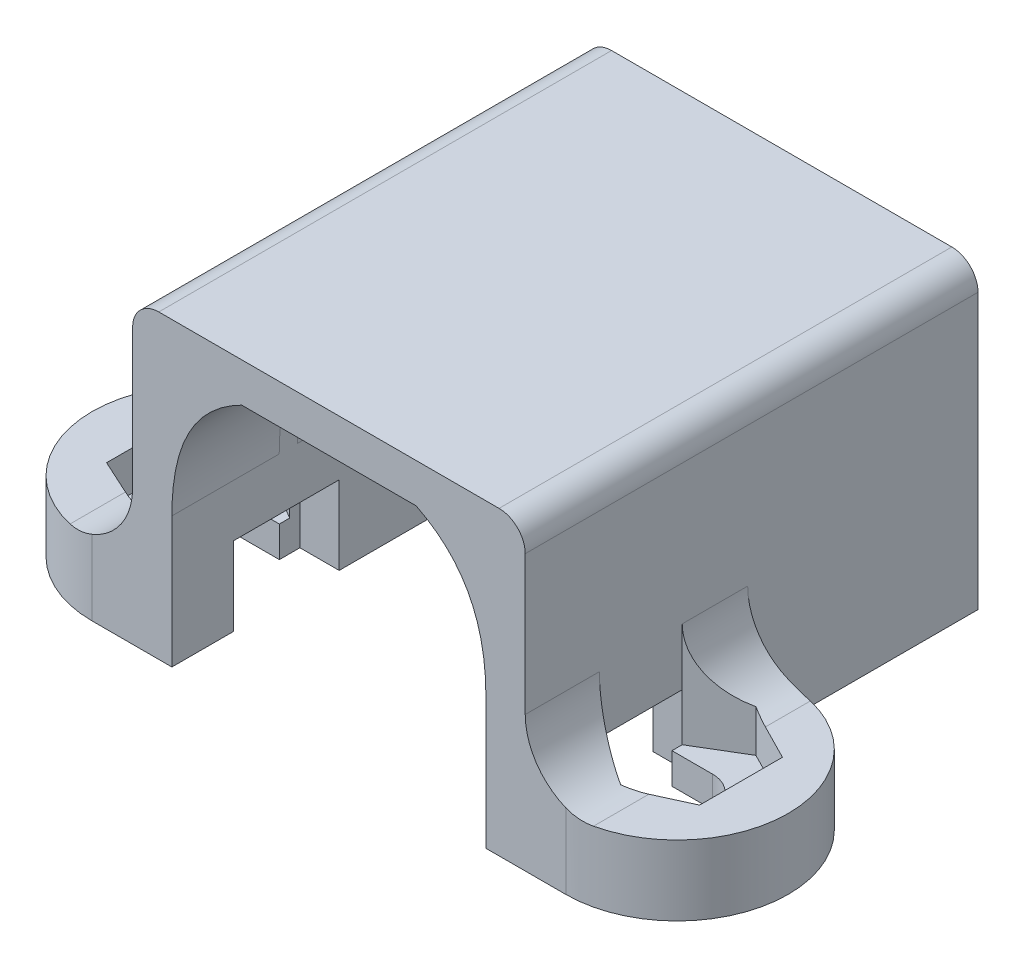
from build123d import *

# Parameters (mm, degrees)
BOSS_EXTRUDE1_DEPTH      = 8.65
BOSS_EXTRUDE1_DEPTH_BACK = 8.65
SKETCH2_W                = 26.6
SKETCH2_H                = 11.5
CUT_EXTRUDE1_DEPTH       = 23.566402017
SKETCH4_W                = 5.8
SKETCH4_H                = 8.8
CUT_EXTRUDE2_DEPTH       = 20.594961087
SKETCH5_W                = 1.5
SKETCH5_H                = 4.03
CUT_EXTRUDE3_DEPTH       = 3
CUT_EXTRUDE4_DEPTH       = 1.4
CUT_EXTRUDE5_START       = -5.1792
CUT_EXTRUDE5_DEPTH       = 4
FILLET3_START            = -7
FILLET3_DEPTH            = 6.429203884
FILLET4_START            = -7
FILLET4_DEPTH            = 6.429203884
CUT_EXTRUDE6_DEPTH       = 23.566402102
FILLET5_R                = 1
SKETCH12_W               = 12
SKETCH12_H               = 1.4
SKETCH12_H_2             = 0.7
CUT_EXTRUDE7_DEPTH       = 10


with BuildPart() as part:
    # Sketch2 → Boss-Extrude1 (new, two sides: drawn at the far end of the back side and taken through both)
    with BuildSketch(Plane.XY.offset(-BOSS_EXTRUDE1_DEPTH_BACK)):
        Rectangle(SKETCH2_W, SKETCH2_H)
    extrude(amount=BOSS_EXTRUDE1_DEPTH + BOSS_EXTRUDE1_DEPTH_BACK)

    # Sketch3 → Cut-Extrude1 (cut, through all)
    with BuildSketch(Plane.XY.offset(8.65)):
        with BuildLine():
            Line((-7.5, 5.75), (-7.5, -0.570796116))
            ThreePointArc((-7.5, -0.570796116), (-8.232233047, -2.338563069), (-10, -3.070796116))
            Line((-10, -3.070796116), (-13.3, -3.070796116))
            Line((-13.3, -3.070796116), (-13.3, 5.75))
            Line((-13.3, 5.75), (-7.5, 5.75))
        make_face()
        with BuildLine():
            Line((7.5, 5.75), (7.5, -0.570796116))
            ThreePointArc((7.5, -0.570796116), (8.232233047, -2.338563069), (10, -3.070796116))
            Line((10, -3.070796116), (13.3, -3.070796116))
            Line((13.3, -3.070796116), (13.3, 5.75))
            Line((13.3, 5.75), (7.5, 5.75))
        make_face()
    extrude(amount=-CUT_EXTRUDE1_DEPTH, mode=Mode.SUBTRACT)

    # Sketch4 → Cut-Extrude2 (cut, through all)
    with BuildSketch(Plane.XZ.offset(5.75)):
        with Locations((-10.4, -4.25)):
            Rectangle(SKETCH4_W, SKETCH4_H)
        with Locations((10.4, -4.25)):
            Rectangle(SKETCH4_W, SKETCH4_H)
    extrude(amount=-CUT_EXTRUDE2_DEPTH, mode=Mode.SUBTRACT)

    # Sketch5 → Cut-Extrude3 (cut)
    with BuildSketch(Plane.XZ.offset(5.75)):
        with Locations((-6.75, 4.27363419)):
            Rectangle(SKETCH5_W, SKETCH5_H)
    cut_extrude3 = extrude(amount=-CUT_EXTRUDE3_DEPTH, mode=Mode.SUBTRACT)

    # Sketch5<3> → Cut-Extrude4 (cut)
    with BuildSketch(Plane.XZ.offset(5.75)):
        with BuildLine():
            ThreePointArc((-9.05, 3.04359822), (-10.2, 4.19359822), (-9.05, 5.34359822))
            Line((-9.05, 5.34359822), (-7.5, 5.34359822))
            Line((-7.5, 5.34359822), (-7.5, 3.04359822))
            Line((-7.5, 3.04359822), (-9.05, 3.04359822))
        make_face()
    cut_extrude4 = extrude(amount=-CUT_EXTRUDE4_DEPTH, mode=Mode.SUBTRACT)

    # Sketch8 → Cut-Extrude5 (cut)
    with BuildSketch(Plane.XZ.offset(5.75).offset(CUT_EXTRUDE5_START)):
        Polygon((-11.329479063, 5.816116205), (-11.329479063, 2.651116205), (-9.259735425, 1.596272871), (-7.5, 2.651116205), (-7.5, 5.816116205), (-9.259735425, 6.763868097), align=None)
    cut_extrude5 = extrude(amount=CUT_EXTRUDE5_DEPTH, mode=Mode.SUBTRACT)

    # Fillet3: read off the stored shape, not the designer's step
    # Fillet3 outline → Fillet3 (cut)
    with BuildSketch(Plane(origin=(0, 0, 0), x_dir=(1, 0, 0), z_dir=(0, 1, 0)).offset(FILLET3_START)):
        with BuildLine():
            Line((-13.3, -8.65), (-9.05, -8.65))
            ThreePointArc((-9.05, -8.65), (-12.05520382, -7.40520382), (-13.3, -4.4))
            Line((-13.3, -4.4), (-13.3, -8.65))
        make_face()
        with BuildLine():
            Line((-13.3, -0.15), (-13.3, -4.4))
            ThreePointArc((-13.3, -4.4), (-12.05520382, -1.39479618), (-9.05, -0.15))
            Line((-9.05, -0.15), (-13.3, -0.15))
        make_face()
    extrude(amount=FILLET3_DEPTH, mode=Mode.SUBTRACT)

    # Mirror4: Cut-Extrude3, Cut-Extrude4, Cut-Extrude5 across plane
    add(cut_extrude3.mirror(Plane(origin=(0, 0, 0), x_dir=(0, 0, 1), z_dir=(1, 0, 0))), mode=Mode.SUBTRACT)
    add(cut_extrude4.mirror(Plane(origin=(0, 0, 0), x_dir=(0, 0, 1), z_dir=(1, 0, 0))), mode=Mode.SUBTRACT)
    add(cut_extrude5.mirror(Plane(origin=(0, 0, 0), x_dir=(0, 0, 1), z_dir=(1, 0, 0))), mode=Mode.SUBTRACT)

    # Fillet4: read off the stored shape, not the designer's step
    # Fillet4 outline → Fillet4 (cut)
    with BuildSketch(Plane(origin=(0, 0, 0), x_dir=(1, 0, 0), z_dir=(0, 1, 0)).offset(FILLET4_START)):
        with BuildLine():
            Line((13.3, -0.15), (9.05, -0.15))
            ThreePointArc((9.05, -0.15), (12.05520382, -1.39479618), (13.3, -4.4))
            Line((13.3, -4.4), (13.3, -0.15))
        make_face()
        with BuildLine():
            Line((13.3, -8.65), (13.3, -4.4))
            ThreePointArc((13.3, -4.4), (12.05520382, -7.40520382), (9.049999999, -8.65))
            Line((9.049999999, -8.65), (13.3, -8.65))
        make_face()
    extrude(amount=FILLET4_DEPTH, mode=Mode.SUBTRACT)

    # Sketch10 → Cut-Extrude6 (cut, through all)
    with BuildSketch(Plane.XY.offset(8.65)):
        with BuildLine():
            Line((-6, -5.75), (6, -5.75))
            Line((6, -5.75), (6, -0.75))
            add(Edge.make_bspline(
                [(6, -0.75), (6, 1.34228193), (5.397693539, 3.219717328), (3.331465755, 4.25)],
                knots=[0, 0, 0, 0, 1, 1, 1, 1], degree=3))
            Line((3.331465755, 4.25), (3.297244701, 4.25))
            Line((3.297244701, 4.25), (-3.331465755, 4.25))
            add(Edge.make_bspline(
                [(-6, -0.75), (-6, 1.34228193), (-5.397693539, 3.219717328), (-3.331465755, 4.25)],
                knots=[0, 0, 0, 0, 1, 1, 1, 1], degree=3))
            Line((-6, -0.75), (-6, -5.75))
        make_face()
    extrude(amount=-CUT_EXTRUDE6_DEPTH, mode=Mode.SUBTRACT)

    # Fillet5
    fillet5_edges = [part.edges().sort_by_distance(p)[0] for p in [
        (-7.5, 5.75, 0),
        (7.5, 5.75, 0),
    ]]
    fillet(fillet5_edges, radius=FILLET5_R)

    # Sketch12 → Cut-Extrude7 (cut)
    with BuildSketch(Plane.XZ.offset(5.75)):
        with Locations((0, -7.95)):
            Rectangle(SKETCH12_W, SKETCH12_H)
        with Locations((0, 0.7)):
            Rectangle(SKETCH12_W, SKETCH12_H_2)
        with Locations((0, 4.2)):
            Rectangle(SKETCH12_W, SKETCH12_H_2)
    extrude(amount=-CUT_EXTRUDE7_DEPTH, mode=Mode.SUBTRACT)


solid = part.part
